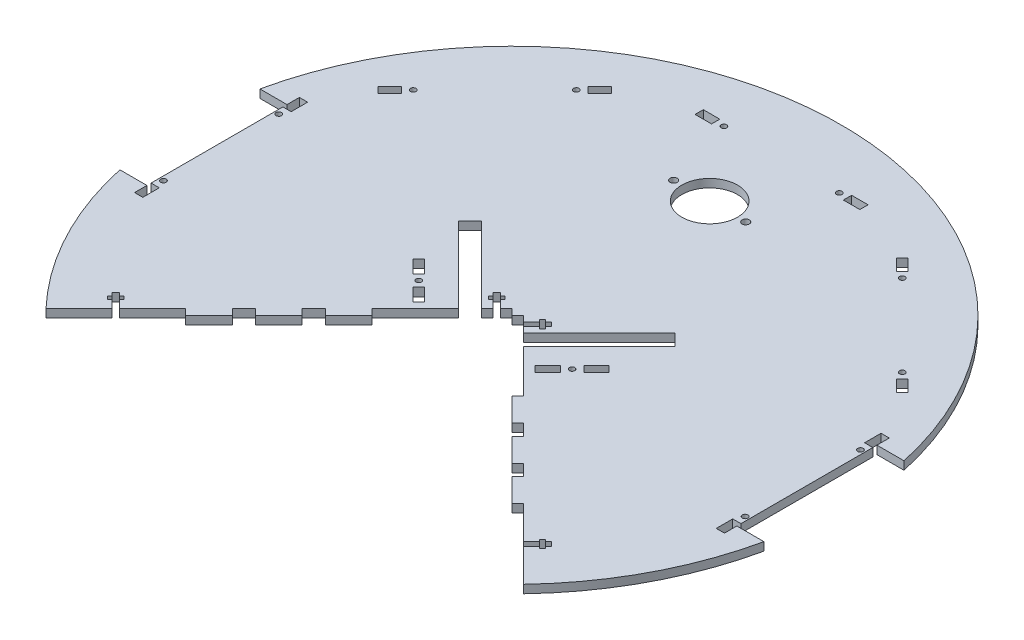
from build123d import *

# Parameters (mm, degrees)
SKETCH1_R                   = 254
BASE_PLATE_DEPTH            = 6.35
V_FUNNEL_CUT_DEPTH          = 360.266367059
SKETCH4_W                   = 26.67
SKETCH4_H                   = 107.95
WHEEL_HOLE_SLOT_DEPTH       = 360.266367059
SKETCH6_R                   = 2.0955
ARM_POST_CONNECTOR_DEPTH    = 356.188713046
SKETCH8_R                   = 2.1336
SKETCH8_W                   = 6.35
SKETCH8_H                   = 12.7
MOTOR_MOUNT_CONNECTOR_DEPTH = 356.188713046
SKETCH9_R                   = 2.1336
SKETCH9_W                   = 12.7
SKETCH9_H                   = 6.35
BACK_MOUNT_CONNECTOR_DEPTH  = 356.188713046
SKETCH10_R                  = 2.1336
SIDE_ASS_CONNECTOR_DEPTH    = 356.188713046
SKETCH11_R                  = 21.463
SKETCH11_R_2                = 2.778125
CASTER_WHEEL_HOLE_DEPTH     = 356.188713046
SKETCH12_W                  = 76.2
SKETCH12_H                  = 6.35
SKETCH12_W_2                = 12.7
V_FUNNEL_TABS_DEPTH         = 6.35
PEG_CLEARANCE_DEPTH         = 356.188713046
V_FUNNEL_T_SLOT_1_DEPTH     = 356.188713046
V_FUNNEL_T_SLOT_2_DEPTH     = 356.188713046


with BuildPart() as part:
    # Sketch1 → Base Plate (new body)
    with BuildSketch(Plane(origin=(0, 0, 0), x_dir=(1, 0, 0), z_dir=(0, 1, 0))):
        Circle(SKETCH1_R)
    extrude(amount=BASE_PLATE_DEPTH)

    # Sketch2 → V Funnel Cut (cut, through all)
    with BuildSketch(Plane(origin=(0, 6.35, 0), x_dir=(1, 0, 0), z_dir=(0, 1, 0))):
        with BuildLine():
            Line((0, 0), (-179.605122421, -179.605122421))
            ThreePointArc((-179.605122421, -179.605122421), (0, -254), (179.605122421, -179.605122421))
            Line((179.605122421, -179.605122421), (0, 0))
        make_face()
    extrude(amount=-V_FUNNEL_CUT_DEPTH, mode=Mode.SUBTRACT)

    # Sketch4 → Wheel Hole Slot (cut, through all)
    with BuildSketch(Plane(origin=(0, 6.35, 0), x_dir=(1, 0, 0), z_dir=(0, 1, 0))):
        with Locations((-240.665, 0)):
            Rectangle(SKETCH4_W, SKETCH4_H)
    wheel_hole_slot = extrude(amount=-WHEEL_HOLE_SLOT_DEPTH, mode=Mode.SUBTRACT)

    # Wheel Slot Mirror: Wheel Hole Slot across plane
    add(wheel_hole_slot.mirror(Plane(origin=(0, 0, 0), x_dir=(0, 0, 1), z_dir=(1, 0, 0))), mode=Mode.SUBTRACT)

    # Sketch6 → Arm Post Connector (cut, through all)
    with BuildSketch(Plane(origin=(0, 6.35, 0), x_dir=(1, 0, 0), z_dir=(0, 1, 0))):
        with Locations((-59.123400668, -12.718648301)):
            Circle(SKETCH6_R)
        Polygon((-61.368464698, -5.98345621), (-71.1004567, 3.748535792), (-75.59058476, -0.741592269), (-65.858592758, -10.473584271), align=None)
        Polygon((-52.388208577, -14.963712331), (-42.656216575, -24.695704333), (-47.146344636, -29.185832393), (-56.878336637, -19.453840392), align=None)
    arm_post_connector = extrude(amount=-ARM_POST_CONNECTOR_DEPTH, mode=Mode.SUBTRACT)

    # Arm Post Connector Mirror: Arm Post Connector across plane
    add(arm_post_connector.mirror(Plane(origin=(0, 0, 0), x_dir=(0, 0, 1), z_dir=(1, 0, 0))), mode=Mode.SUBTRACT)

    # Sketch8 → Motor Mount Connector (cut, through all)
    with BuildSketch(Plane.XZ):
        with Locations((-224.155, -44.45)):
            Circle(SKETCH8_R)
        with Locations((-224.155, 44.45)):
            Circle(SKETCH8_R)
        with Locations((-224.155, -57.15)):
            Rectangle(SKETCH8_W, SKETCH8_H)
        with Locations((-224.155, 57.15)):
            Rectangle(SKETCH8_W, SKETCH8_H)
    motor_mount_connector = extrude(amount=-MOTOR_MOUNT_CONNECTOR_DEPTH, mode=Mode.SUBTRACT)

    # Motor Mount Connector Mirror: Motor Mount Connector across plane
    add(motor_mount_connector.mirror(Plane(origin=(0, 0, 0), x_dir=(0, 0, 1), z_dir=(1, 0, 0))), mode=Mode.SUBTRACT)

    # Sketch9 → Back Mount Connector (cut, through all)
    with BuildSketch(Plane.XZ):
        with Locations((-44.45, -207.81727558)):
            Circle(SKETCH9_R)
        with Locations((44.45, -207.81727558)):
            Circle(SKETCH9_R)
        with Locations((-57.15, -207.81727558)):
            Rectangle(SKETCH9_W, SKETCH9_H)
        with Locations((57.15, -207.81727558)):
            Rectangle(SKETCH9_W, SKETCH9_H)
    extrude(amount=-BACK_MOUNT_CONNECTOR_DEPTH, mode=Mode.SUBTRACT)

    # Sketch10 → Side Ass Connector (cut, through all)
    with BuildSketch(Plane.XZ):
        with Locations((-188.470279928, -112.368300127)):
            Circle(SKETCH10_R)
        with Locations((-125.608487081, -175.230092975)):
            Circle(SKETCH10_R)
        Polygon((-204.18572814, -101.142979976), (-195.205472019, -110.123236097), (-190.715343959, -105.633108037), (-199.69560008, -96.652851915), align=None)
        Polygon((-123.363423051, -181.965285066), (-114.38316693, -190.945541187), (-109.893038869, -186.455413126), (-118.87329499, -177.475157005), align=None)
    side_ass_connector = extrude(amount=-SIDE_ASS_CONNECTOR_DEPTH, mode=Mode.SUBTRACT)

    # Side Ass Connector Mirror: Side Ass Connector across plane
    add(side_ass_connector.mirror(Plane(origin=(0, 0, 0), x_dir=(0, 0, 1), z_dir=(1, 0, 0))), mode=Mode.SUBTRACT)

    # Sketch11 → Caster Wheel Hole (cut, through all)
    with BuildSketch(Plane(origin=(0, 6.35, 0), x_dir=(1, 0, 0), z_dir=(0, 1, 0))):
        with Locations((0, 152.4)):
            Circle(SKETCH11_R)
        with Locations((27.78125, 152.4)):
            Circle(SKETCH11_R_2)
        with Locations((-27.78125, 152.4)):
            Circle(SKETCH11_R_2)
    extrude(amount=-CASTER_WHEEL_HOLE_DEPTH, mode=Mode.SUBTRACT)

    # Sketch12 → V Funnel Tabs (cut)
    with BuildSketch(Plane(origin=(0, 0, 0), x_dir=(0.7071067811865489, 0, -0.7071067811865462), z_dir=(0.7071067811865462, 0, 0.7071067811865489))):
        with Locations((-215.9, 3.175)):
            Rectangle(SKETCH12_W, SKETCH12_H)
        with Locations((-146.05, 3.175)):
            Rectangle(SKETCH12_W_2, SKETCH12_H)
        with Locations((-107.95, 3.175)):
            Rectangle(SKETCH12_W_2, SKETCH12_H)
        with Locations((-38.1, 3.175)):
            Rectangle(SKETCH12_W, SKETCH12_H)
    v_funnel_tabs = extrude(amount=-V_FUNNEL_TABS_DEPTH, mode=Mode.SUBTRACT)

    # V Funnel Tab Mirror: V Funnel Tabs across plane
    add(v_funnel_tabs.mirror(Plane(origin=(0, 0, 0), x_dir=(0, 0, 1), z_dir=(1, 0, 0))), mode=Mode.SUBTRACT)

    # Sketch13 → Peg Clearance (cut, through all)
    with BuildSketch(Plane(origin=(0, 6.35, 0), x_dir=(1, 0, 0), z_dir=(0, 1, 0))):
        Polygon((-11.689323621, -11.689323621), (-20.669579742, -20.669579742), (-83.53137259, 42.192213105), (-74.551116468, 51.172469226), align=None)
    peg_clearance = extrude(amount=-PEG_CLEARANCE_DEPTH, mode=Mode.SUBTRACT)

    # Peg Clearance Mirror: Peg Clearance across plane
    add(peg_clearance.mirror(Plane(origin=(0, 0, 0), x_dir=(0, 0, 1), z_dir=(1, 0, 0))), mode=Mode.SUBTRACT)

    # Sketch14 → V Funnel T Slot 1 (cut, through all)
    with BuildSketch(Plane(origin=(0, 6.35, 0), x_dir=(1, 0, 0), z_dir=(0, 1, 0))):
        Polygon((-11.843472899, -2.863216778), (-8.826106843, 0.154149278), (-15.022483566, 6.350526002), (-13.388076952, 7.984932616), (-15.633140982, 10.229996646), (-17.267547597, 8.595590032), (-19.602414188, 10.930456624), (-22.619780245, 7.913090567), (-20.284913653, 5.578223975), (-21.919320267, 3.943817361), (-19.674256237, 1.698753331), (-18.039849623, 3.333159945), align=None)
    v_funnel_t_slot_1 = extrude(amount=-V_FUNNEL_T_SLOT_1_DEPTH, mode=Mode.SUBTRACT)

    # Sketch15 → V Funnel T Slot 2 (cut, through all)
    with BuildSketch(Plane(origin=(0, 6.35, 0), x_dir=(1, 0, 0), z_dir=(0, 1, 0))):
        Polygon((-158.663165147, -149.682909026), (-155.64579909, -146.665542969), (-161.842175814, -140.469166246), (-160.2077692, -138.834759632), (-162.45283323, -136.589695601), (-164.087239844, -138.224102215), (-166.422106436, -135.889235624), (-169.439472492, -138.906601681), (-167.104605901, -141.241468272), (-168.739012515, -142.875874886), (-166.493948485, -145.120938916), (-164.859541871, -143.486532302), align=None)
    v_funnel_t_slot_2 = extrude(amount=-V_FUNNEL_T_SLOT_2_DEPTH, mode=Mode.SUBTRACT)

    # Mirror1: V Funnel T Slot 1, V Funnel T Slot 2 across plane
    add(v_funnel_t_slot_1.mirror(Plane(origin=(0, 0, 0), x_dir=(0, 0, 1), z_dir=(1, 0, 0))), mode=Mode.SUBTRACT)
    add(v_funnel_t_slot_2.mirror(Plane(origin=(0, 0, 0), x_dir=(0, 0, 1), z_dir=(1, 0, 0))), mode=Mode.SUBTRACT)


solid = part.part
